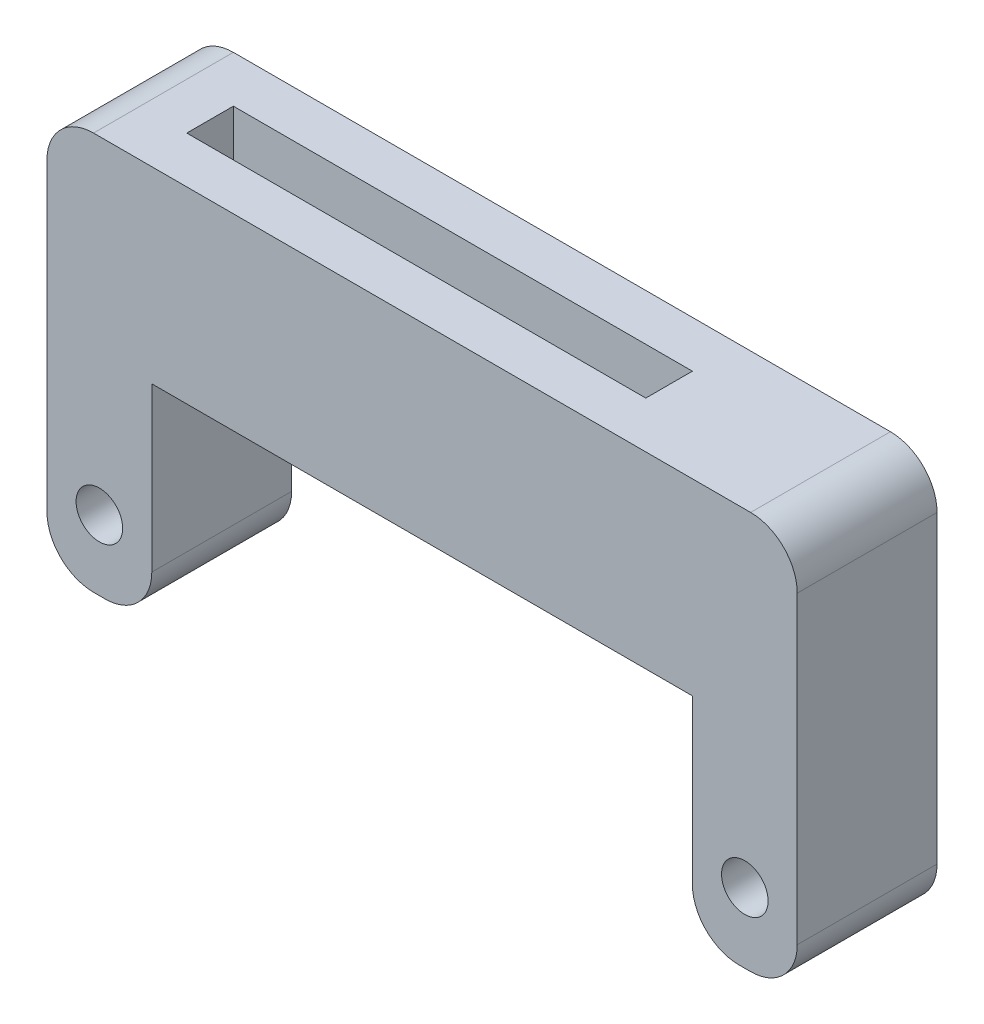
from build123d import *

# Parameters (mm, degrees)
SKETCH2_W           = 32.2
SKETCH2_H           = 17.068
BOSS_EXTRUDE1_DEPTH = 3
SKETCH3_W           = 19.7
SKETCH3_H           = 2
CUT_EXTRUDE1_DEPTH  = 5
SKETCH4_W           = 23.2
SKETCH4_H           = 9
CUT_EXTRUDE2_DEPTH  = 20.18434664
SKETCH5_R           = 1
CUT_EXTRUDE3_DEPTH  = 20.18434664
FILLET1_R           = 2


with BuildPart() as part:
    # Sketch2 → Boss-Extrude1 (new, symmetric)
    with BuildSketch(Plane.XY):
        Rectangle(SKETCH2_W, SKETCH2_H)
    extrude(amount=BOSS_EXTRUDE1_DEPTH, both=True)

    # Sketch3 → Cut-Extrude1 (cut)
    with BuildSketch(Plane(origin=(0, 8.534, 0), x_dir=(1, 0, 0), z_dir=(0, 1, 0))):
        with Locations((-2.25, 0)):
            Rectangle(SKETCH3_W, SKETCH3_H)
    extrude(amount=-CUT_EXTRUDE1_DEPTH, mode=Mode.SUBTRACT)

    # Sketch4 → Cut-Extrude2 (cut, through all)
    with BuildSketch(Plane.XY.offset(3)):
        with Locations((0, -4.034)):
            Rectangle(SKETCH4_W, SKETCH4_H)
    extrude(amount=-CUT_EXTRUDE2_DEPTH, mode=Mode.SUBTRACT)

    # Sketch5 → Cut-Extrude3 (cut, through all)
    with BuildSketch(Plane.XY.offset(3)):
        with Locations((-13.85, -5.534)):
            Circle(SKETCH5_R)
        with Locations((13.85, -5.534)):
            Circle(SKETCH5_R)
    extrude(amount=-CUT_EXTRUDE3_DEPTH, mode=Mode.SUBTRACT)

    # Fillet1
    fillet1_edges = [part.edges().sort_by_distance(p)[0] for p in [
        (-16.1, -8.534, 0),
        (-11.6, -8.534, 0),
        (11.6, -8.534, 0),
        (16.1, -8.534, 0),
        (16.1, 8.534, 0),
        (-16.1, 8.534, 0),
    ]]
    fillet(fillet1_edges, radius=FILLET1_R)


solid = part.part
